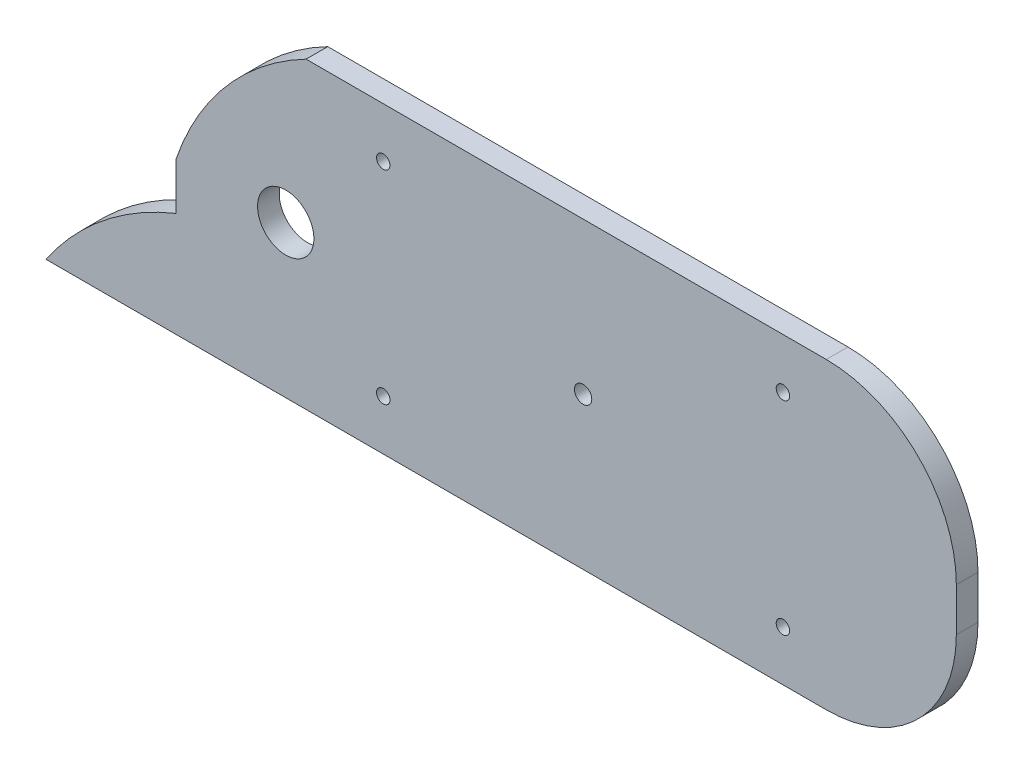
from build123d import *

# Parameters (mm, degrees)
BOSS_EXTRUDE1_DEPTH = 12.7
SKETCH4_R           = 5.08
SKETCH4_R_2         = 3.937
SKETCH4_R_3         = 16.51
CUT_EXTRUDE2_DEPTH  = 563.396381567


with BuildPart() as part:
    # Sketch2 → Boss-Extrude1 (new body)
    with BuildSketch(Plane.XY):
        with BuildLine():
            Line((0, 0), (457.2, 0))
            ThreePointArc((457.2, 0), (511.081536726, 22.318463274), (533.4, 76.2))
            Line((533.4, 76.2), (533.4, 101.6))
            ThreePointArc((533.4, 101.6), (511.081536726, 155.481536726), (457.2, 177.8))
            Line((457.2, 177.8), (152.4, 177.8))
            ThreePointArc((152.4, 177.8), (105.657968509, 140.757455564), (76.2, 88.9))
            Line((76.2, 88.9), (76.2, 61.401251199))
            ThreePointArc((76.2, 61.401251199), (33.506060073, 36.401783403), (0, 0))
        make_face()
    extrude(amount=BOSS_EXTRUDE1_DEPTH)

    # Sketch4 → Cut-Extrude2 (cut, through all)
    with BuildSketch(Plane.XY.offset(12.7)):
        with Locations((314.706, 88.9)):
            Circle(SKETCH4_R)
        with Locations((431.8, 148.4376)):
            Circle(SKETCH4_R_2)
        with Locations((140.468339853, 88.9)):
            Circle(SKETCH4_R_3)
        with Locations((197.612, 148.4376)):
            Circle(SKETCH4_R_2)
        with Locations((197.612, 29.3624)):
            Circle(SKETCH4_R_2)
        with Locations((431.8, 29.3624)):
            Circle(SKETCH4_R_2)
    extrude(amount=-CUT_EXTRUDE2_DEPTH, mode=Mode.SUBTRACT)


solid = part.part
